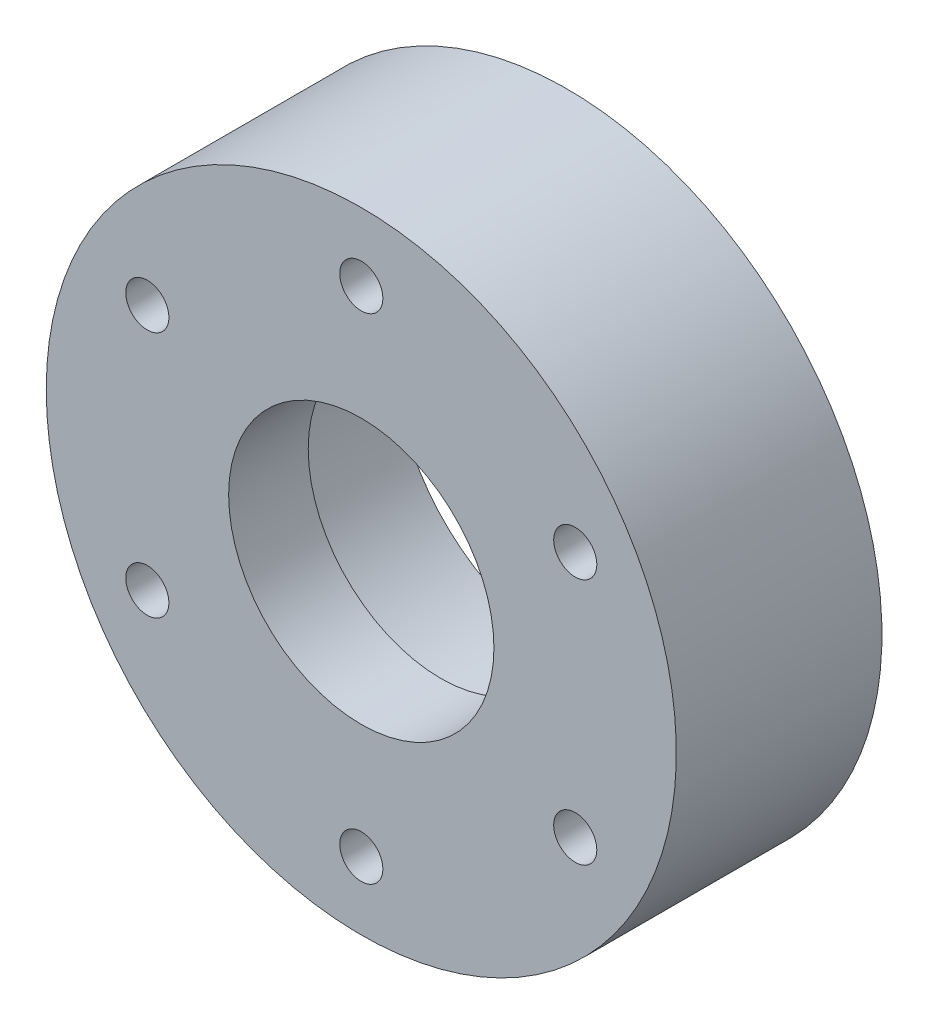
from build123d import *

# Parameters (mm, degrees)
SKETCH2_R          = 3.25
CUT_EXTRUDE1_DEPTH = 74.98310618
CIRPATTERN1_COUNT  = 6


with BuildPart() as part:
    # Sketch1 → Revolve1 (revolve)
    with BuildSketch(Plane(origin=(0, 0, -159.952320541), x_dir=(0, 0, -1), z_dir=(1, 0, 0))):
        Polygon((-31, 47.5), (0, 47.5), (0, 26), (-19, 26), (-19, 20), (-31, 20), align=None)
    revolve(axis=Axis((0, 0, -159.952320541), (0, 0, 1)))

    # Sketch2 → Cut-Extrude1 (cut, through all)
    with BuildSketch(Plane.XY.offset(-128.952320541)):
        with Locations((0, 37.25)):
            Circle(SKETCH2_R)
    cut_extrude1 = extrude(amount=-CUT_EXTRUDE1_DEPTH, mode=Mode.SUBTRACT)

    # CirPattern1: Cut-Extrude1 ×6 about axis
    cirpattern1_axis = Axis((0, 0, -159.952320541), (0, 0, -1))
    for i in range(1, CIRPATTERN1_COUNT):
        add(cut_extrude1.rotate(cirpattern1_axis, i * 360 / CIRPATTERN1_COUNT), mode=Mode.SUBTRACT)


solid = part.part
